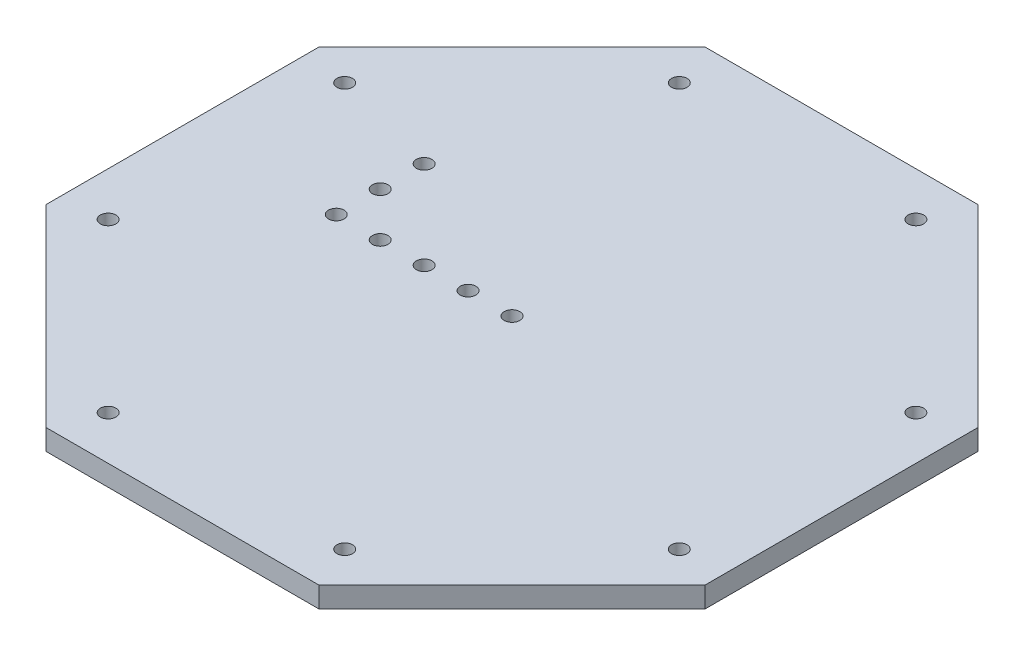
from build123d import *

# Parameters (mm, degrees)
BASE_DEPTH            = 5.9944
MOUNTING_HOLES_D      = 4.4958
F_8_CLEARANCE_HOLE1_D = 4.4958


with BuildPart() as part:
    # Sketch1 → Base (new body)
    with BuildSketch(Plane(origin=(0, 0, 0), x_dir=(1, 0, 0), z_dir=(0, 1, 0))):
        Polygon((-39.453841816, 95.25), (-95.25, 39.453841816), (-95.25, -39.453841816), (-39.453841816, -95.25), (39.453841816, -95.25), (95.25, -39.453841816), (95.25, 39.453841816), (39.453841816, 95.25), align=None)
    extrude(amount=BASE_DEPTH)

    # Mounting holes (through all)
    with Locations(Plane(origin=(0, 5.9944, 0), x_dir=(1, 0, 0), z_dir=(0, 1, 0))):
        with Locations((-34.193329574, 82.55), (34.193329574, 82.55), (82.55, 34.193329574), (82.55, -34.193329574), (34.193329574, -82.55), (-34.193329574, -82.55), (-82.55, -34.193329574), (-82.55, 34.193329574)):
            Hole(MOUNTING_HOLES_D / 2)

    # #8 Clearance Hole1 (through all)
    with Locations(Plane(origin=(0, 5.9944, 0), x_dir=(1, 0, 0), z_dir=(0, 1, 0))):
        with Locations((0, 0), (-12.7, 0), (-25.4, 0), (-38.1, 0), (-50.8, 0), (-50.8, 12.7), (-50.8, 25.4)):
            Hole(F_8_CLEARANCE_HOLE1_D / 2)


solid = part.part
